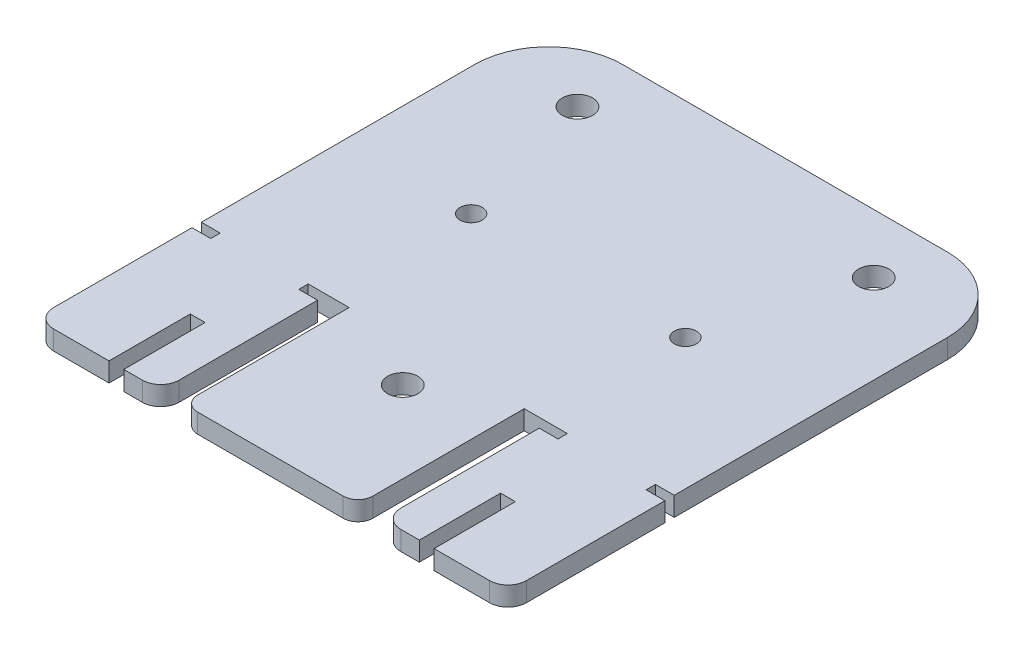
from build123d import *

# Parameters (mm, degrees)
MAIN_BODY_DEPTH          = 2.6
SCREW_HOLES_DEPTH        = 57.095989161
SCREW_HOLES_DEPTH_BACK   = 57.095989161
SKETCH2_R                = 2.05
SKETCH2_R_2              = 1.5
MAIN_LOWER_BODY_FILLET_R = 2
SKETCH5_W                = 17
SKETCH5_H                = 2.6
BOSS_EXTRUDE1_DEPTH      = 22.5
SKETCH6_W                = 2
SKETCH6_H                = 11
CUT_EXTRUDE1_DEPTH       = 22.5
FILLET2_R                = 2.5
SKETCH7_W                = 2.54
SKETCH7_H                = 1.27
CUT_EXTRUDE2_DEPTH       = 57.095989161


with BuildPart() as part:
    # Sketch1 → Main Body (new body)
    with BuildSketch(Plane(origin=(0, 0, 0), x_dir=(1, 0, 0), z_dir=(0, 1, 0))):
        with BuildLine():
            Line((11.7, -23.5), (32, -23.5))
            Line((32, -23.5), (32, 13.5))
            ThreePointArc((32, 13.5), (29.071067812, 20.571067812), (22, 23.5))
            Line((22, 23.5), (-22, 23.5))
            ThreePointArc((-22, 23.5), (-29.071067812, 20.571067812), (-32, 13.5))
            Line((-32, 13.5), (-32, -23.5))
            Line((-32, -23.5), (-12, -23.5))
            Line((-12, -23.5), (-12, -46))
            Line((-12, -46), (11.7, -46))
            Line((11.7, -46), (11.7, -23.5))
        make_face()
    extrude(amount=MAIN_BODY_DEPTH)

    # Sketch2 → Screw holes (cut, two sides: drawn at the far end of the back side and taken through both)
    with BuildSketch(Plane(origin=(0, 2.6, 0), x_dir=(1, 0, 0), z_dir=(0, 1, 0)).offset(-SCREW_HOLES_DEPTH_BACK)):
        with Locations((-20.1, 15.4999906)):
            Circle(SKETCH2_R)
        with Locations((20, 15.5)):
            Circle(SKETCH2_R)
        with Locations((-14.740009048, -4.250009446)):
            Circle(SKETCH2_R_2)
        with Locations((14.259990952, -4.250009446)):
            Circle(SKETCH2_R_2)
        with Locations((0.7, -28.9500094)):
            Circle(SKETCH2_R)
    extrude(amount=SCREW_HOLES_DEPTH + SCREW_HOLES_DEPTH_BACK, mode=Mode.SUBTRACT)

    # Main lower body Fillet
    main_lower_body_fillet_edges = [part.edges().sort_by_distance(p)[0] for p in [
        (11.7, 1.3, 46),
        (-12, 1.3, 46),
    ]]
    fillet(main_lower_body_fillet_edges, radius=MAIN_LOWER_BODY_FILLET_R)

    # Sketch5 → Boss-Extrude1 (add)
    with BuildSketch(Plane.XY.offset(23.5)):
        with Locations((-23.5, 1.3)):
            Rectangle(SKETCH5_W, SKETCH5_H)
        with Locations((23.5, 1.3)):
            Rectangle(SKETCH5_W, SKETCH5_H)
    extrude(amount=BOSS_EXTRUDE1_DEPTH)

    # Sketch6 → Cut-Extrude1 (cut)
    with BuildSketch(Plane(origin=(0, 2.6, 0), x_dir=(1, 0, 0), z_dir=(0, 1, 0))):
        with Locations((-21, -40.5)):
            Rectangle(SKETCH6_W, SKETCH6_H)
        with Locations((21, -40.5)):
            Rectangle(SKETCH6_W, SKETCH6_H)
    extrude(amount=-CUT_EXTRUDE1_DEPTH, mode=Mode.SUBTRACT)

    # Fillet2
    fillet2_edges = [part.edges().sort_by_distance(p)[0] for p in [
        (-32, 1.3, 46),
        (-15, 1.3, 46),
        (15, 1.3, 46),
        (32, 1.3, 46),
    ]]
    fillet(fillet2_edges, radius=FILLET2_R)

    # Sketch7 → Cut-Extrude2 (cut, through all)
    with BuildSketch(Plane(origin=(0, 2.6, 0), x_dir=(1, 0, 0), z_dir=(0, 1, 0))):
        with Locations((-30.73, -24.135)):
            Rectangle(SKETCH7_W, SKETCH7_H)
        with Locations((30.73, -24.135)):
            Rectangle(SKETCH7_W, SKETCH7_H)
        with Locations((-16.27, -24.135)):
            Rectangle(SKETCH7_W, SKETCH7_H)
        with Locations((16.27, -24.135)):
            Rectangle(SKETCH7_W, SKETCH7_H)
    extrude(amount=-CUT_EXTRUDE2_DEPTH, mode=Mode.SUBTRACT)


solid = part.part
